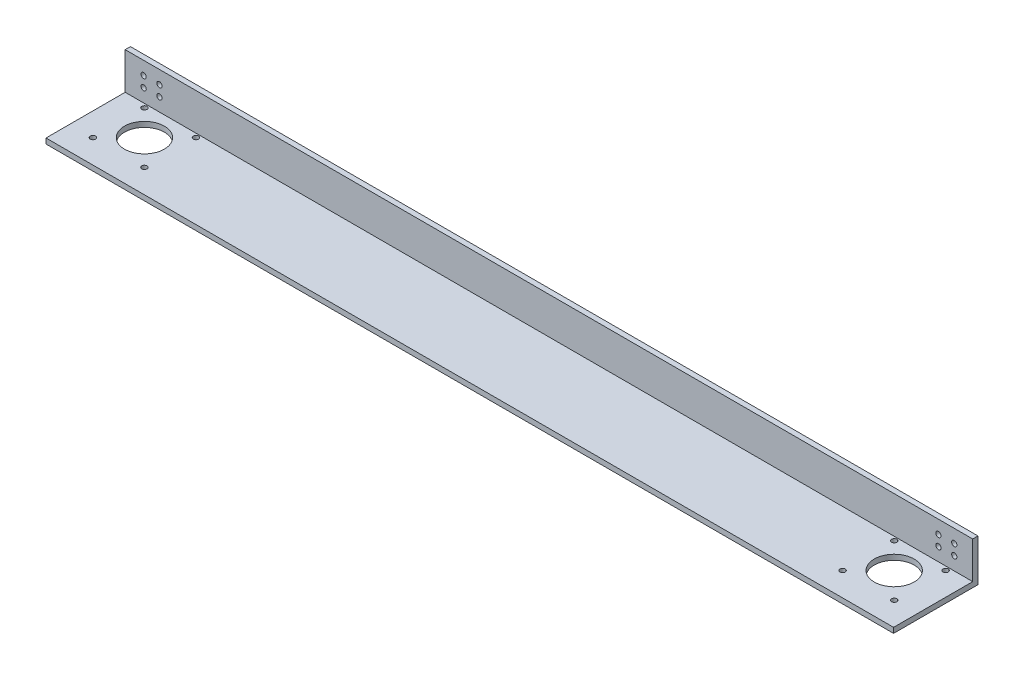
from build123d import *

# Parameters (mm, degrees)
BOSS_EXTRUDE1_DEPTH            = 510
BOTTHOMHOLES_SKETCH2_R         = 12
BOTTHOMHOLES_SKETCH2_R_2       = 1.5875
BOTTOMHOLES_CUT_EXTRUDE1_DEPTH = 514.005448923
SIDEHOLES_SKETCH3_R            = 1.5875
SIDEHOLES_CUT_EXTRUDE2_DEPTH   = 514.152803753


with BuildPart() as part:
    # Sketch1 → Boss-Extrude1 (new body)
    with BuildSketch(Plane(origin=(0, 0, 0), x_dir=(0, 0, -1), z_dir=(1, 0, 0))):
        Polygon((0, 0), (-50.8, 0), (-50.8, 3.175), (-3.175, 3.175), (-3.175, 25.4), (0, 25.4), align=None)
    extrude(amount=BOSS_EXTRUDE1_DEPTH)

    # BotthomHoles-Sketch2 → BottomHoles-Cut-Extrude1 (cut, through all)
    with BuildSketch(Plane(origin=(0, 3.175, 0), x_dir=(1, 0, 0), z_dir=(0, 1, 0))):
        with Locations((29.425, -21)):
            Circle(BOTTHOMHOLES_SKETCH2_R)
        with Locations((480.575, -21)):
            Circle(BOTTHOMHOLES_SKETCH2_R)
        with Locations((13.925, -5.5)):
            Circle(BOTTHOMHOLES_SKETCH2_R_2)
        with Locations((44.925, -5.5)):
            Circle(BOTTHOMHOLES_SKETCH2_R_2)
        with Locations((465.075, -5.5)):
            Circle(BOTTHOMHOLES_SKETCH2_R_2)
        with Locations((496.075, -5.5)):
            Circle(BOTTHOMHOLES_SKETCH2_R_2)
        with Locations((13.925, -36.5)):
            Circle(BOTTHOMHOLES_SKETCH2_R_2)
        with Locations((44.925, -36.5)):
            Circle(BOTTHOMHOLES_SKETCH2_R_2)
        with Locations((465.075, -36.5)):
            Circle(BOTTHOMHOLES_SKETCH2_R_2)
        with Locations((496.075, -36.5)):
            Circle(BOTTHOMHOLES_SKETCH2_R_2)
    extrude(amount=-BOTTOMHOLES_CUT_EXTRUDE1_DEPTH, mode=Mode.SUBTRACT)

    # SideHoles-Sketch3 → SideHoles-Cut-Extrude2 (cut, through all)
    with BuildSketch(Plane(origin=(0, 0, 0), x_dir=(-1, 0, 0), z_dir=(0, 0, -1))):
        with Locations((-498.8875, 17.4625)):
            Circle(SIDEHOLES_SKETCH3_R)
        with Locations((-489.3625, 17.4625)):
            Circle(SIDEHOLES_SKETCH3_R)
        with Locations((-498.8875, 11.1125)):
            Circle(SIDEHOLES_SKETCH3_R)
        with Locations((-489.3625, 11.1125)):
            Circle(SIDEHOLES_SKETCH3_R)
        with Locations((-11.1125, 11.1125)):
            Circle(SIDEHOLES_SKETCH3_R)
        with Locations((-20.6375, 11.1125)):
            Circle(SIDEHOLES_SKETCH3_R)
        with Locations((-20.6375, 17.4625)):
            Circle(SIDEHOLES_SKETCH3_R)
        with Locations((-11.1125, 17.4625)):
            Circle(SIDEHOLES_SKETCH3_R)
    extrude(amount=-SIDEHOLES_CUT_EXTRUDE2_DEPTH, mode=Mode.SUBTRACT)


solid = part.part
